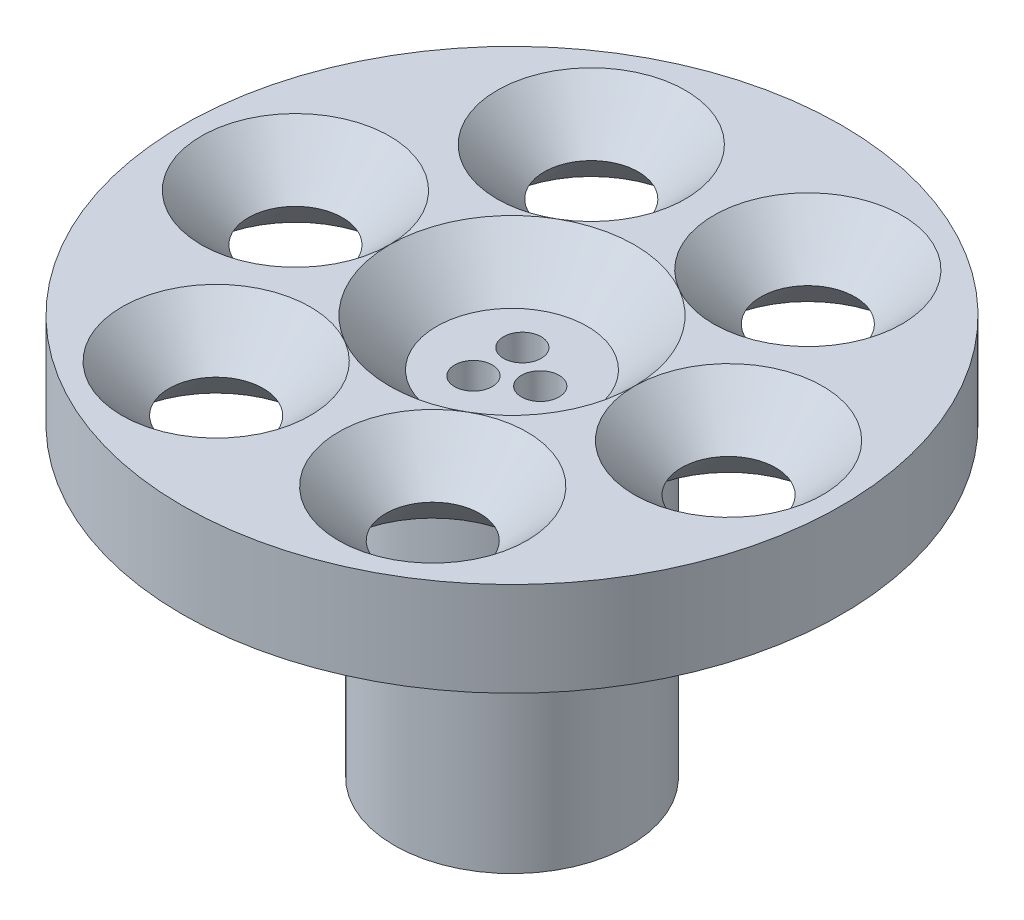
from build123d import *

# Parameters (mm, degrees)
SKETCH1_R           = 12.5
SKETCH1_R_2         = 2
BOSS_EXTRUDE1_DEPTH = 42.5
SKETCH2_R           = 5.5
CUT_EXTRUDE1_DEPTH  = 1.5
BOSS_EXTRUDE3_START = -10
SKETCH3_R           = 35
SKETCH3_R_2         = 12.5
BOSS_EXTRUDE3_DEPTH = 10
SKETCH4_R           = 5
CUT_EXTRUDE5_DEPTH  = 10
CHAMFER7_SIZE       = 5
CUT_EXTRUDE6_START  = -5
SKETCH7_R           = 8
SKETCH7_R_2         = 5.5
SKETCH7_R_3         = 2
CUT_EXTRUDE6_DEPTH  = 5
CHAMFER8_SIZE       = 5


with BuildPart() as part:
    # Sketch1 → Boss-Extrude1 (new body)
    with BuildSketch(Plane(origin=(0, 0, 0), x_dir=(1, 0, 0), z_dir=(0, 1, 0))):
        with Locations(Location((0, 0, 0), (0, 0, 270))):
            Circle(SKETCH1_R)
        with Locations(Location((3, 0, 0), (0, 0, 270))):
            Circle(SKETCH1_R_2, mode=Mode.SUBTRACT)
        with Locations(Location((-1.5, -2.598076211, 0), (0, 0, 270))):
            Circle(SKETCH1_R_2, mode=Mode.SUBTRACT)
        with Locations(Location((-1.5, 2.598076211, 0), (0, 0, 270))):
            Circle(SKETCH1_R_2, mode=Mode.SUBTRACT)
    extrude(amount=BOSS_EXTRUDE1_DEPTH)

    # Sketch2 → Cut-Extrude1 (cut)
    with BuildSketch(Plane.XZ):
        with Locations(Location((0, 0, 0), (0, 0, 270))):
            Circle(SKETCH2_R)
    extrude(amount=-CUT_EXTRUDE1_DEPTH, mode=Mode.SUBTRACT)

    # Sketch3 → Boss-Extrude3 (add)
    with BuildSketch(Plane(origin=(0, 42.5, 0), x_dir=(1, 0, 0), z_dir=(0, 1, 0)).offset(BOSS_EXTRUDE3_START)):
        with Locations(Location((0, 0, 0), (0, 0, 270))):
            Circle(SKETCH3_R)
        with Locations(Location((0, 0, 0), (0, 0, 270))):
            Circle(SKETCH3_R_2, mode=Mode.SUBTRACT)
    extrude(amount=BOSS_EXTRUDE3_DEPTH)

    # Sketch4 → Cut-Extrude5 (cut)
    with BuildSketch(Plane(origin=(0, 42.5, 0), x_dir=(1, 0, 0), z_dir=(0, 1, 0))):
        with Locations(Location((-23, 0, 0), (0, 0, 270))):
            Circle(SKETCH4_R)
        with Locations(Location((-11.5, 19.918584287, 0), (0, 0, 270))):
            Circle(SKETCH4_R)
        with Locations(Location((11.5, 19.918584287, 0), (0, 0, 270))):
            Circle(SKETCH4_R)
        with Locations(Location((23, 0, 0), (0, 0, 270))):
            Circle(SKETCH4_R)
        with Locations(Location((11.5, -19.918584287, 0), (0, 0, 270))):
            Circle(SKETCH4_R)
        with Locations(Location((-11.5, -19.918584287, 0), (0, 0, 270))):
            Circle(SKETCH4_R)
    extrude(amount=-CUT_EXTRUDE5_DEPTH, mode=Mode.SUBTRACT)

    # Chamfer7
    chamfer7_edges = [part.edges().sort_by_distance(p)[0] for p in [
        (-23, 32.5, -5),
        (-23, 42.5, -5),
        (-11.5, 32.5, 14.918584287),
        (-11.5, 42.5, 14.918584287),
        (11.5, 32.5, 14.918584287),
        (11.5, 42.5, 14.918584287),
        (23, 32.5, -5),
        (23, 42.5, -5),
        (11.5, 32.5, -24.918584287),
        (11.5, 42.5, -24.918584287),
        (-11.5, 32.5, -24.918584287),
        (-11.5, 42.5, -24.918584287),
    ]]
    chamfer(chamfer7_edges, length=CHAMFER7_SIZE - 0.0001)  # a hair under: the kernel refuses the full size

    # Sketch7 → Cut-Extrude6 (cut)
    # profile 1 of 2: a face of its own
    with BuildSketch(Plane(origin=(0, 42.5, 0), x_dir=(1, 0, 0), z_dir=(0, 1, 0)).offset(CUT_EXTRUDE6_START)):
        with Locations(Location((0, 0, 0), (0, 0, 270))):
            Circle(SKETCH7_R)
        with Locations(Location((0, 0, 0), (0, 0, 90))):
            Circle(SKETCH7_R_2, mode=Mode.SUBTRACT)
    # profile 2 of 2: a face of its own
    with BuildSketch(Plane(origin=(0, 42.5, 0), x_dir=(1, 0, 0), z_dir=(0, 1, 0)).offset(CUT_EXTRUDE6_START)):
        with Locations(Location((0, 0, 0), (0, 0, 90))):
            Circle(SKETCH7_R_2)
        with Locations(Location((-1.5, 2.598076211, 0), (0, 0, 90))):
            Circle(SKETCH7_R_3, mode=Mode.SUBTRACT)
        with Locations(Location((-1.5, -2.598076211, 0), (0, 0, 90))):
            Circle(SKETCH7_R_3, mode=Mode.SUBTRACT)
        with Locations(Location((3, 0, 0), (0, 0, 90))):
            Circle(SKETCH7_R_3, mode=Mode.SUBTRACT)
    extrude(amount=CUT_EXTRUDE6_DEPTH, mode=Mode.SUBTRACT)

    # Chamfer8
    chamfer8_edges = [part.edges().sort_by_distance(p)[0] for p in [
        (0, 42.5, -8),
    ]]
    chamfer(chamfer8_edges, length=CHAMFER8_SIZE - 0.0001)  # a hair under: the kernel refuses the full size


solid = part.part
